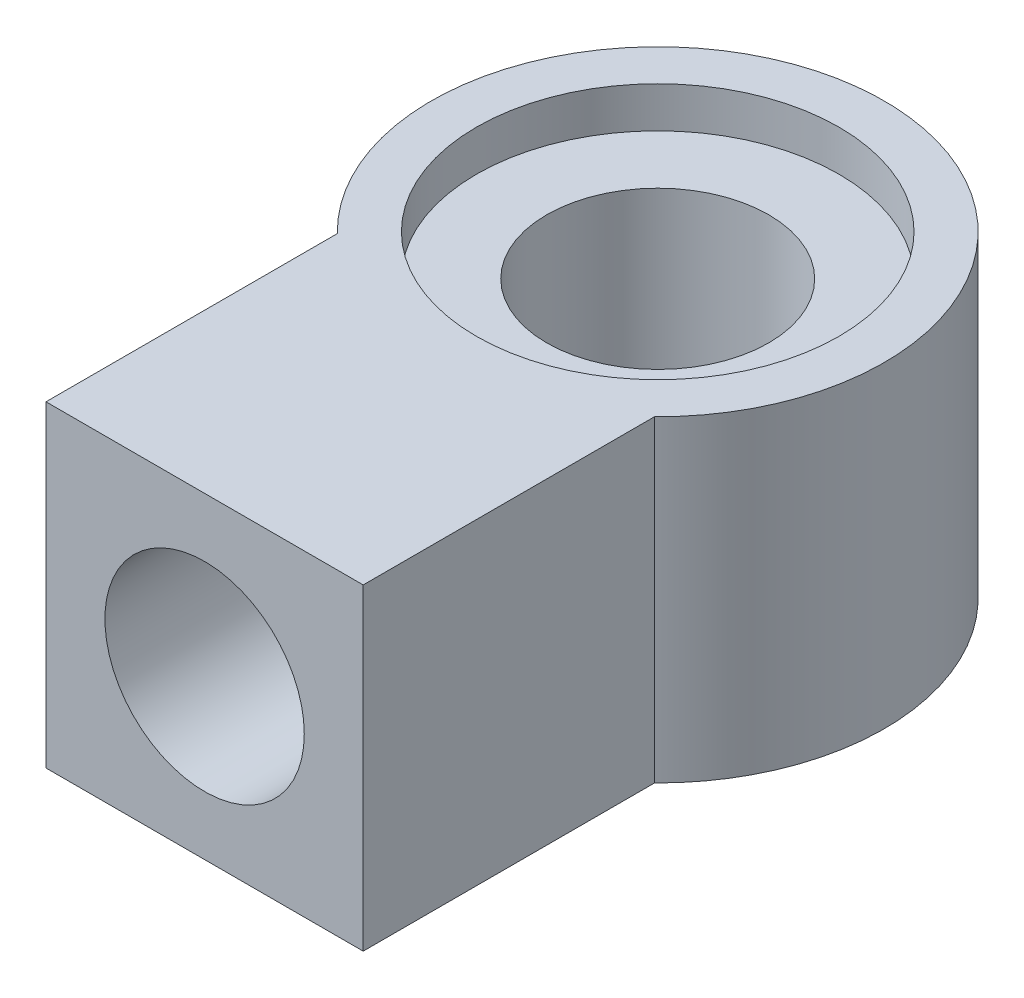
from build123d import *

# Parameters (mm, degrees)
SKETCH1_R           = 5
SKETCH1_R_2         = 2.45
BOSS_EXTRUDE1_DEPTH = 7
SKETCH2_W           = 7
SKETCH2_H           = 7
BOSS_EXTRUDE3_DEPTH = 1.5
SKETCH4_W           = 7
SKETCH4_H           = 7
SKETCH4_R           = 2.2
BOSS_EXTRUDE4_DEPTH = 5
SKETCH5_R           = 4
CUT_EXTRUDE1_DEPTH  = 0.9


with BuildPart() as part:
    # Sketch1 → Boss-Extrude1 (new body)
    with BuildSketch(Plane(origin=(0, 0, 0), x_dir=(1, 0, 0), z_dir=(0, 1, 0))):
        Circle(SKETCH1_R)
        Circle(SKETCH1_R_2, mode=Mode.SUBTRACT)
    extrude(amount=BOSS_EXTRUDE1_DEPTH)

    # Sketch2 → Boss-Extrude3 (add)
    with BuildSketch(Plane.XY.offset(5)):
        with Locations((0, 3.5)):
            Rectangle(SKETCH2_W, SKETCH2_H)
    extrude(amount=-BOSS_EXTRUDE3_DEPTH)

    # Sketch4 → Boss-Extrude4 (add)
    with BuildSketch(Plane.XY.offset(5)):
        with Locations((0, 3.5)):
            Rectangle(SKETCH4_W, SKETCH4_H)
        with Locations((0, 3.5)):
            Circle(SKETCH4_R, mode=Mode.SUBTRACT)
    extrude(amount=BOSS_EXTRUDE4_DEPTH)

    # Sketch5 → Cut-Extrude1 (cut)
    with BuildSketch(Plane(origin=(0, 7, 0), x_dir=(1, 0, 0), z_dir=(0, 1, 0))):
        Circle(SKETCH5_R)
    extrude(amount=-CUT_EXTRUDE1_DEPTH, mode=Mode.SUBTRACT)


solid = part.part
